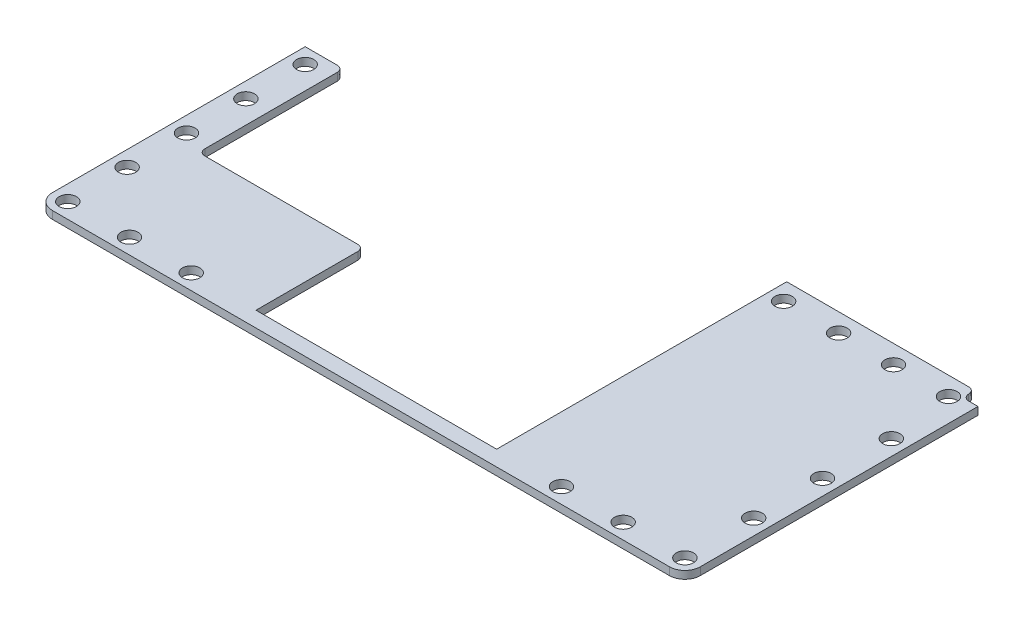
from build123d import *

# Parameters (mm, degrees)
BOSS_EXTRUDE1_DEPTH     = 1.5875
CUT_EXTRUDE1_DEPTH      = 92.65197219
CUT_EXTRUDE1_DEPTH_BACK = 92.65197219
SKETCH2_R               = 1.778
FILLET1_R               = 1.27
CUT_EXTRUDE2_DEPTH      = 92.65197219
CUT_EXTRUDE2_DEPTH_BACK = 92.65197219
SKETCH3_W               = 34.036
SKETCH3_H               = 12.7
FILLET2_R               = 1.27


with BuildPart() as part:
    # Sketch1 → Boss-Extrude1 (new body)
    with BuildSketch(Plane(origin=(0, 0, 0), x_dir=(1, 0, 0), z_dir=(0, 1, 0))):
        with BuildLine():
            Line((-66.675, 3.175), (-66.675, 55.209357386))
            Line((-66.675, 55.209357386), (-58.801, 55.209357386))
            Line((-58.801, 55.209357386), (-58.801, 36.83))
            Line((-58.801, 36.83), (-24.765, 36.83))
            Line((-24.765, 36.83), (-24.765, 3.175))
            Line((-24.765, 3.175), (24.765, 3.175))
            Line((24.765, 3.175), (24.765, 62.865))
            Line((24.765, 62.865), (62.23, 62.865))
            ThreePointArc((62.23, 62.865), (63.128025612, 62.493025612), (63.5, 61.595))
            ThreePointArc((63.5, 61.595), (63.871974388, 60.696974388), (64.77, 60.325))
            Line((64.77, 60.325), (66.675, 60.325))
            Line((66.675, 60.325), (66.675, 3.175))
            ThreePointArc((66.675, 3.175), (65.74506403, 0.92993597), (63.5, 0))
            Line((63.5, 0), (-63.5, 0))
            ThreePointArc((-63.5, 0), (-65.74506403, 0.92993597), (-66.675, 3.175))
        make_face()
    extrude(amount=BOSS_EXTRUDE1_DEPTH)

    # Sketch2 → Cut-Extrude1 (cut, two sides: drawn at the far end of the back side and taken through both)
    with BuildSketch(Plane(origin=(0, 1.5875, 0), x_dir=(-1, 0, 0), z_dir=(0, 1, 0)).offset(-CUT_EXTRUDE1_DEPTH_BACK)):
        with Locations((63.5, -3.175)):
            Circle(SKETCH2_R)
        with Locations((50.8, -3.175)):
            Circle(SKETCH2_R)
        with Locations((38.1, -3.175)):
            Circle(SKETCH2_R)
        with Locations((-38.1, -3.175)):
            Circle(SKETCH2_R)
        with Locations((-50.8, -3.175)):
            Circle(SKETCH2_R)
        with Locations((-63.5, -3.175)):
            Circle(SKETCH2_R)
        with Locations((63.5, -15.389839347)):
            Circle(SKETCH2_R)
        with Locations((63.5, -27.604678693)):
            Circle(SKETCH2_R)
        with Locations((63.5, -39.81951804)):
            Circle(SKETCH2_R)
        with Locations((63.5, -52.034357386)):
            Circle(SKETCH2_R)
        with Locations((-63.5, -17.337603912)):
            Circle(SKETCH2_R)
        with Locations((-63.5, -31.500207823)):
            Circle(SKETCH2_R)
        with Locations((-63.5, -45.662811735)):
            Circle(SKETCH2_R)
        with Locations((-61.869746345, -59.055)):
            Circle(SKETCH2_R)
        with Locations((-50.559830897, -59.055)):
            Circle(SKETCH2_R)
        with Locations((-39.249915448, -59.055)):
            Circle(SKETCH2_R)
        with Locations((-27.94, -59.055)):
            Circle(SKETCH2_R)
    extrude(amount=CUT_EXTRUDE1_DEPTH + CUT_EXTRUDE1_DEPTH_BACK, mode=Mode.SUBTRACT)

    # Fillet1
    fillet1_edges = [part.edges().sort_by_distance(p)[0] for p in [
        (-24.765, 0.79375, -36.83),
        (-58.801, 0.79375, -36.83),
        (-58.801, 0.79375, -55.209357386),
    ]]
    fillet(fillet1_edges, radius=FILLET1_R)

    # Sketch3 → Cut-Extrude2 (cut, two sides: drawn at the far end of the back side and taken through both)
    with BuildSketch(Plane(origin=(0, 1.5875, 0), x_dir=(1, 0, 0), z_dir=(0, 1, 0)).offset(-CUT_EXTRUDE2_DEPTH_BACK)):
        with Locations((-41.783, 31.75)):
            Rectangle(SKETCH3_W, SKETCH3_H)
    extrude(amount=CUT_EXTRUDE2_DEPTH + CUT_EXTRUDE2_DEPTH_BACK, mode=Mode.SUBTRACT)

    # Fillet2
    fillet2_edges = [part.edges().sort_by_distance(p)[0] for p in [
        (-24.765, 0.79375, -25.4),
        (-58.801, 0.79375, -25.4),
    ]]
    fillet(fillet2_edges, radius=FILLET2_R)


solid = part.part
